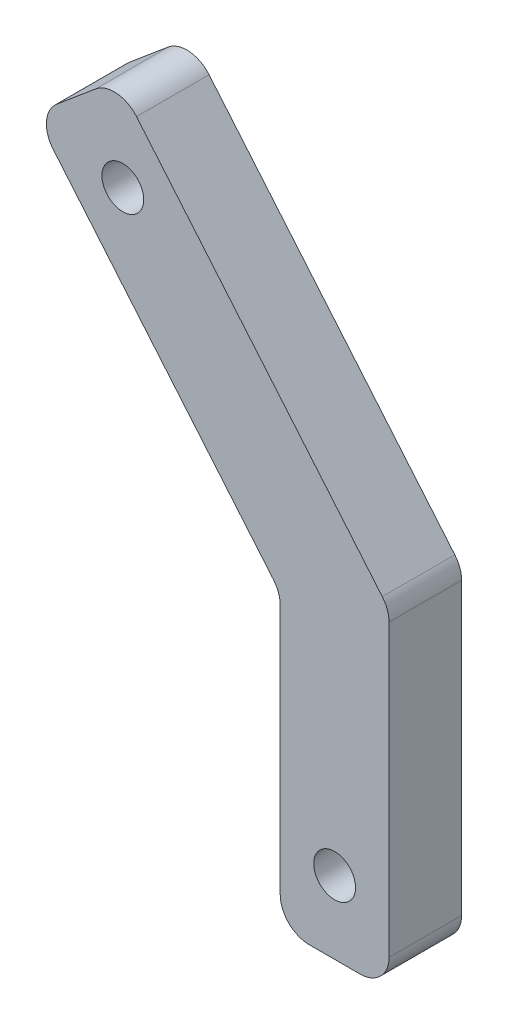
from build123d import *

# Parameters (mm, degrees)
BOSS_EXTRUDE1_DEPTH       = 6.35
FILLET1_R                 = 2.54
F_6_CLEARANCE_HOLE1_D     = 3.6576
F_6_CLEARANCE_HOLE1_DEPTH = 10.16
F_6_CLEARANCE_HOLE1_TIP   = 1.0988539


with BuildPart() as part:
    # Sketch1 → Boss-Extrude1 (new body)
    with BuildSketch(Plane.XY):
        Polygon((0, 0), (7.296573321, 6.122551982), (31.02898218, -22.160631536), (31.02898218, -51.027448018), (21.50398218, -51.027448018), (21.50398218, -25.627448018), align=None)
    extrude(amount=BOSS_EXTRUDE1_DEPTH)

    # Fillet1
    fillet1_edges = [part.edges().sort_by_distance(p)[0] for p in [
        (7.296573321, 6.122551982, 3.175),
        (0, 0, 3.175),
        (31.02898218, -51.027448018, 3.175),
        (21.50398218, -51.027448018, 3.175),
        (31.02898218, -22.160631536, 3.175),
        (21.50398218, -25.627448018, 3.175),
    ]]
    fillet(fillet1_edges, radius=FILLET1_R)

    # #6 Clearance Hole1
    with Locations(Plane.XY.offset(6.35)):
        with Locations((7.729987982, -1.803106223), (26.26648218, -44.677448018)):
            Hole(F_6_CLEARANCE_HOLE1_D / 2, depth=F_6_CLEARANCE_HOLE1_DEPTH)
            with Locations((0, 0, -(F_6_CLEARANCE_HOLE1_DEPTH + F_6_CLEARANCE_HOLE1_TIP / 2))):  # 118° drill point
                Cone(0, F_6_CLEARANCE_HOLE1_D / 2, F_6_CLEARANCE_HOLE1_TIP, mode=Mode.SUBTRACT)


solid = part.part
